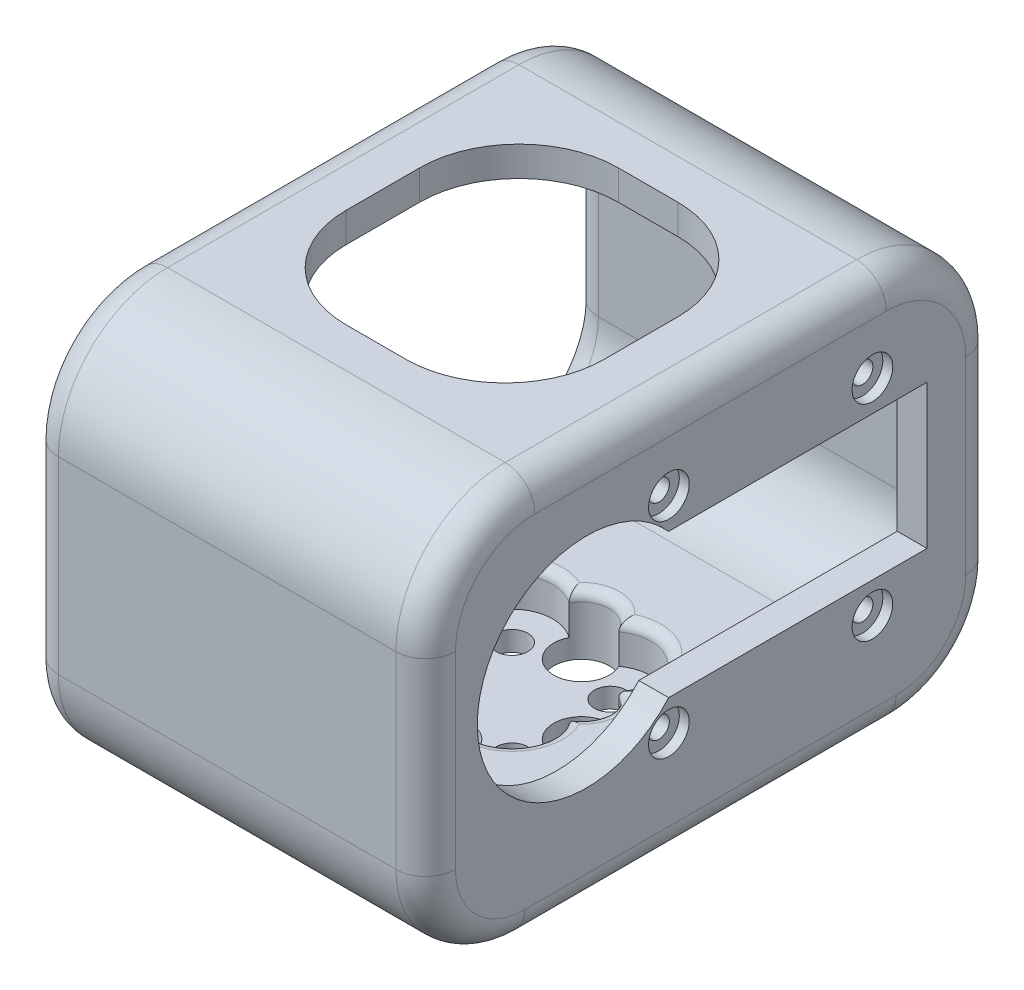
from build123d import *

# Parameters (mm, degrees)
BOSS_EXTRUDE1_DEPTH      = 40
BOSS_EXTRUDE2_DEPTH      = 16.2
BOSS_EXTRUDE2_DEPTH_BACK = 41.2
CUT_EXTRUDE1_DEPTH       = 62.316311043636674
CUT_EXTRUDE1_DEPTH_BACK  = 62.316311043636674
CUT_EXTRUDE3_DEPTH       = 37
CUT_EXTRUDE3_DEPTH_BACK  = 62.316311043636674
CUT_EXTRUDE4_REACH       = 71.982
SKETCH7_R                = 1.5999999999999999
SKETCH7_R_2              = 1.6000000000000019
SKETCH7_R_3              = 2.7999999999999985
SKETCH7_R_4              = 2.800000000000002
FILLET2_R                = 10
FILLET3_R                = 3
CUT_EXTRUDE5_REACH       = 71.982
FILLET4_R                = 10
CUT_EXTRUDE6_START       = -4
SKETCH9_R                = 4.100000000000003
SKETCH9_R_2              = 1.6000000000000019
SKETCH9_R_3              = 4.100000000000001
SKETCH9_R_4              = 1.5999999999999999
CUT_EXTRUDE6_DEPTH       = 4
CUT_EXTRUDE7_REACH       = 63.316
SKETCH10_R               = 1.050000000000002
SKETCH10_R_2             = 1.049999999999999
SKETCH10_R_3             = 1.0500000000000025
SKETCH10_R_4             = 1.0499999999999985
SKETCH10_3_R             = 2.0500000000000003
SKETCH10_3_R_2           = 1.050000000000002
SKETCH10_3_R_3           = 1.049999999999999
SKETCH10_3_R_4           = 2.0499999999999985
SKETCH10_3_R_5           = 1.0499999999999985
SKETCH10_3_R_6           = 1.0500000000000025
CUT_EXTRUDE8_DEPTH       = 1
CUT_EXTRUDE9_START       = -4
CUT_EXTRUDE9_DEPTH       = 4
FILLET5_R                = 1


with BuildPart() as part:
    # Sketch1 → Boss-Extrude1 (new body)
    with BuildSketch(Plane(origin=(0, 0, 0), x_dir=(0, 0, 1), z_dir=(1, 0, 0))):
        with BuildLine():
            Line((-30.19999999999992, 18.5), (5.199999999999948, 18.5))
            ThreePointArc((5.199999999999948, 18.5), (12.978174593052039, 15.278174593052016), (16.200000000000006, 7.49999999999992))
            Line((16.200000000000006, 7.49999999999992), (16.200000000000003, -7.499999999999942))
            ThreePointArc((16.200000000000003, -7.499999999999942), (12.978174593052016, -15.27817459305203), (5.199999999999922, -18.5))
            Line((5.199999999999922, -18.5), (-30.199999999999942, -18.5))
            ThreePointArc((-30.199999999999942, -18.5), (-37.97817459305203, -15.278174593052018), (-41.2, -7.49999999999992))
            Line((-41.2, -7.49999999999992), (-41.2, 7.499999999999923))
            ThreePointArc((-41.2, 7.499999999999923), (-37.978174593052024, 15.278174593052025), (-30.19999999999992, 18.5))
        make_face()
    extrude(amount=BOSS_EXTRUDE1_DEPTH)

    # Sketch5 → Boss-Extrude2 (add, two sides: drawn at the far end of the back side and taken through both)
    with BuildSketch(Plane(origin=(0, 0, 0), x_dir=(0, 1, 0), z_dir=(0, 0, 1)).offset(-BOSS_EXTRUDE2_DEPTH_BACK)):
        Polygon((-21.5, -9.6e-15), (0, 0), (0, -40), (-21.5, -40), align=None)
    extrude(amount=BOSS_EXTRUDE2_DEPTH + BOSS_EXTRUDE2_DEPTH_BACK)

    # Sketch1<9> → Cut-Extrude1 (cut, two sides: drawn at the far end of the back side and taken through both)
    with BuildSketch(Plane(origin=(0, 0, 0), x_dir=(0, 0, 1), z_dir=(1, 0, 0)).offset(-CUT_EXTRUDE1_DEPTH_BACK)):
        with BuildLine():
            ThreePointArc((-8.272696053887305, -7.2499999999998215), (11, -2.66e-15), (-8.272696053887302, 7.249999999999826))
            Line((-8.272696053887364, 7.2499999999998765), (-34.30020581413727, 7.2499999999999964))
            Line((-34.30020581413727, 7.2499999999999964), (-34.30020581413727, -7.2500000000000036))
            Line((-34.30020581413727, -7.250000000000004), (-8.272696053887366, -7.249999999999876))
        make_face()
    extrude(amount=CUT_EXTRUDE1_DEPTH + CUT_EXTRUDE1_DEPTH_BACK, mode=Mode.SUBTRACT)

    # Sketch1<10> → Cut-Extrude3 (cut, two sides: drawn at the far end of the back side and taken through both)
    with BuildSketch(Plane(origin=(0, 0, 0), x_dir=(0, 0, 1), z_dir=(1, 0, 0)).offset(-CUT_EXTRUDE3_DEPTH_BACK)):
        with BuildLine():
            Line((-38.199999999999996, 7.499999999999942), (-38.199999999999996, -7.499999999999942))
            ThreePointArc((-38.199999999999996, -7.499999999999942), (-35.85685424949238, -13.156854249492376), (-30.199999999999942, -15.5))
            Line((-30.199999999999942, -15.5), (5.1999999999999424, -15.5))
            ThreePointArc((5.1999999999999424, -15.5), (10.856854249492383, -13.15685424949238), (13.200000000000001, -7.499999999999942))
            Line((13.200000000000001, -7.499999999999942), (13.200000000000003, 7.499999999999942))
            ThreePointArc((13.200000000000003, 7.499999999999942), (10.856854249492384, 13.15685424949238), (5.199999999999948, 15.5))
            Line((5.199999999999948, 15.5), (-30.199999999999942, 15.5))
            ThreePointArc((-30.199999999999942, 15.5), (-35.85685424949238, 13.156854249492376), (-38.199999999999996, 7.499999999999942))
        make_face()
    extrude(amount=CUT_EXTRUDE3_DEPTH + CUT_EXTRUDE3_DEPTH_BACK, mode=Mode.SUBTRACT)

    # Sketch7 → Cut-Extrude4 (cut, up to next)
    with BuildSketch(Plane.XZ.offset(21.5), mode=Mode.PRIVATE) as cut_extrude4_sk1:
        with Locations(Location((15.049999999999999, -7.549999999999998, 0), (0, 0, 270))):
            Circle(SKETCH7_R)
    cut_extrude4_tool1 = extrude(cut_extrude4_sk1.sketch, amount=-CUT_EXTRUDE4_REACH, mode=Mode.PRIVATE) & part.part
    # Sketch7 → Cut-Extrude4 (cut, up to next)
    with BuildSketch(Plane.XZ.offset(21.5), mode=Mode.PRIVATE) as cut_extrude4_sk2:
        with Locations(Location((24.95, -7.549999999999998, 0), (0, 0, 270))):
            Circle(SKETCH7_R_2)
    cut_extrude4_tool2 = extrude(cut_extrude4_sk2.sketch, amount=-CUT_EXTRUDE4_REACH, mode=Mode.PRIVATE) & part.part
    # Sketch7 → Cut-Extrude4 (cut, up to next)
    with BuildSketch(Plane.XZ.offset(21.5), mode=Mode.PRIVATE) as cut_extrude4_sk3:
        with Locations(Location((24.950000000000003, -17.45, 0), (0, 0, 270))):
            Circle(SKETCH7_R_2)
    cut_extrude4_tool3 = extrude(cut_extrude4_sk3.sketch, amount=-CUT_EXTRUDE4_REACH, mode=Mode.PRIVATE) & part.part
    # Sketch7 → Cut-Extrude4 (cut, up to next)
    with BuildSketch(Plane.XZ.offset(21.5), mode=Mode.PRIVATE) as cut_extrude4_sk4:
        with Locations(Location((15.05, -17.45, 0), (0, 0, 270))):
            Circle(SKETCH7_R_2)
    cut_extrude4_tool4 = extrude(cut_extrude4_sk4.sketch, amount=-CUT_EXTRUDE4_REACH, mode=Mode.PRIVATE) & part.part
    # Sketch7 → Cut-Extrude4 (cut, up to next)
    with BuildSketch(Plane.XZ.offset(21.5), mode=Mode.PRIVATE) as cut_extrude4_sk5:
        with Locations(Location((12.999642866253186, -12.500000000000005, 0), (0, 0, 270))):
            Circle(SKETCH7_R_3)
    cut_extrude4_tool5 = extrude(cut_extrude4_sk5.sketch, amount=-CUT_EXTRUDE4_REACH, mode=Mode.PRIVATE) & part.part
    # Sketch7 → Cut-Extrude4 (cut, up to next)
    with BuildSketch(Plane.XZ.offset(21.5), mode=Mode.PRIVATE) as cut_extrude4_sk6:
        with Locations(Location((20.000000000000007, -5.499642866253184, 0), (0, 0, 270))):
            Circle(SKETCH7_R_4)
    cut_extrude4_tool6 = extrude(cut_extrude4_sk6.sketch, amount=-CUT_EXTRUDE4_REACH, mode=Mode.PRIVATE) & part.part
    # Sketch7 → Cut-Extrude4 (cut, up to next)
    with BuildSketch(Plane.XZ.offset(21.5), mode=Mode.PRIVATE) as cut_extrude4_sk7:
        with Locations(Location((20.00000000000001, -19.500357133746824, 0), (0, 0, 270))):
            Circle(SKETCH7_R_3)
    cut_extrude4_tool7 = extrude(cut_extrude4_sk7.sketch, amount=-CUT_EXTRUDE4_REACH, mode=Mode.PRIVATE) & part.part
    # Sketch7 → Cut-Extrude4 (cut, up to next)
    with BuildSketch(Plane.XZ.offset(21.5), mode=Mode.PRIVATE) as cut_extrude4_sk8:
        with Locations(Location((27.000357133746828, -12.5, 0), (0, 0, 270))):
            Circle(SKETCH7_R_3)
    cut_extrude4_tool8 = extrude(cut_extrude4_sk8.sketch, amount=-CUT_EXTRUDE4_REACH, mode=Mode.PRIVATE) & part.part
    add(cut_extrude4_tool1.solids().sort_by_distance((15.05, -21.5, -7.55))[0], mode=Mode.SUBTRACT)
    add(cut_extrude4_tool2.solids().sort_by_distance((24.95, -21.5, -7.55))[0], mode=Mode.SUBTRACT)
    add(cut_extrude4_tool3.solids().sort_by_distance((24.95, -21.5, -17.45))[0], mode=Mode.SUBTRACT)
    add(cut_extrude4_tool4.solids().sort_by_distance((15.05, -21.5, -17.45))[0], mode=Mode.SUBTRACT)
    add(cut_extrude4_tool5.solids().sort_by_distance((12.999643, -21.5, -12.5))[0], mode=Mode.SUBTRACT)
    add(cut_extrude4_tool6.solids().sort_by_distance((20, -21.5, -5.499643))[0], mode=Mode.SUBTRACT)
    add(cut_extrude4_tool7.solids().sort_by_distance((20, -21.5, -19.500357))[0], mode=Mode.SUBTRACT)
    add(cut_extrude4_tool8.solids().sort_by_distance((27.000357, -21.5, -12.5))[0], mode=Mode.SUBTRACT)

    # Fillet2
    fillet2_edges = [part.edges().sort_by_distance(p)[0] for p in [
        (20.000000000000004, -21.5, -41.2),
        (20.000000000000004, -21.5, 16.2),
    ]]
    fillet(fillet2_edges, radius=FILLET2_R)

    # Fillet3
    # the kernel refuses this fillet: 3 mm, written as the material it takes off along each edge
    with BuildSketch(Plane(origin=(40, 7.500000000000001, -30.200000000000006), x_dir=(0, 1, 5.81e-15), z_dir=(0, -5.81e-15, 1))) as fillet3_piece_1:
        with BuildLine():
            CenterArc((11 - FILLET3_R, FILLET3_R), FILLET3_R, 270, 90)
            Line((11, FILLET3_R), (11, 0))
            Line((11, 0), (11 - FILLET3_R, 0))
        make_face()
    revolve(axis=Axis((40, 7.500000000000001, -30.200000000000006), (-1, 0, 0)), revolution_arc=90.00000000000077, mode=Mode.SUBTRACT)
    with BuildSketch(Plane(origin=(0, 7.499999999999996, 5.199999999999998), x_dir=(0, -4.84e-15, 1), z_dir=(0, -1, -4.84e-15))) as fillet3_piece_2:
        with BuildLine():
            CenterArc((11.000000000000004 - FILLET3_R, -FILLET3_R), FILLET3_R, 8.48e-15, 90)
            Line((11.000000000000004, -FILLET3_R), (11.000000000000004, 0))
            Line((11.000000000000004, 0), (11.000000000000004 - FILLET3_R, 0))
        make_face()
    revolve(axis=Axis((0, 7.499999999999996, 5.199999999999998), (-1, 0, 0)), revolution_arc=90.00000000000067, mode=Mode.SUBTRACT)
    with BuildSketch(Plane(origin=(0, 18.5, 5.199999999999922), x_dir=(0, -1, 0), z_dir=(0, 0, -1))) as fillet3_piece_3:
        with BuildLine():
            CenterArc((FILLET3_R, -FILLET3_R), FILLET3_R, 90, 90)
            Line((0, -FILLET3_R), (0, 0))
            Line((0, 0), (FILLET3_R, 0))
        make_face()
    extrude(amount=35.399999999999864, mode=Mode.SUBTRACT)
    with BuildSketch(Plane(origin=(0, 7.500000000000001, -30.200000000000006), x_dir=(0, 1, 5.81e-15), z_dir=(0, -5.81e-15, 1))) as fillet3_piece_4:
        with BuildLine():
            CenterArc((11 - FILLET3_R, -FILLET3_R), FILLET3_R, 0, 90)
            Line((11 - FILLET3_R, 4.4e-16), (11, 0))
            Line((11, 0), (11, -FILLET3_R))
        make_face()
    revolve(axis=Axis((0, 7.500000000000001, -30.200000000000006), (-1, 0, 0)), revolution_arc=90.00000000000077, mode=Mode.SUBTRACT)
    with BuildSketch(Plane(origin=(40, 18.5, 5.199999999999922), x_dir=(0, -1, 0), z_dir=(0, 0, -1))) as fillet3_piece_5:
        with BuildLine():
            CenterArc((FILLET3_R, FILLET3_R), FILLET3_R, 180, 90)
            Line((0, FILLET3_R), (0, 0))
            Line((0, 0), (FILLET3_R, 0))
        make_face()
    extrude(amount=35.399999999999864, mode=Mode.SUBTRACT)
    with BuildSketch(Plane(origin=(9.6e-15, -21.5, -31.200000000000003), x_dir=(-3.2e-15, 1, 0), z_dir=(0, 0, 1))) as fillet3_piece_6:
        with BuildLine():
            CenterArc((FILLET3_R, -FILLET3_R), FILLET3_R, 89.99999999999982, 90.00000000000013)
            Line((-9.6e-15, -FILLET3_R), (0, 0))
            Line((0, 0), (FILLET3_R, 0))
        make_face()
    extrude(amount=37.40000000000001, mode=Mode.SUBTRACT)
    with BuildSketch(Plane(origin=(40, -21.5, -31.200000000000003), x_dir=(0, 1, 0), z_dir=(0, 0, 1))) as fillet3_piece_7:
        with BuildLine():
            CenterArc((FILLET3_R, FILLET3_R), FILLET3_R, 180, 90)
            Line((0, FILLET3_R), (0, 0))
            Line((0, 0), (FILLET3_R, 0))
        make_face()
    extrude(amount=37.40000000000001, mode=Mode.SUBTRACT)
    with BuildSketch(Plane(origin=(40, 7.499999999999942, 16.200000000000003), x_dir=(0, 1.2e-16, -1), z_dir=(0, -1, -1.2e-16))) as fillet3_piece_8:
        with BuildLine():
            CenterArc((FILLET3_R, -FILLET3_R), FILLET3_R, 90, 90)
            Line((0, -FILLET3_R), (0, 0))
            Line((0, 0), (FILLET3_R, 0))
        make_face()
    extrude(amount=18.99999999999994, mode=Mode.SUBTRACT)
    with BuildSketch(Plane(origin=(40, 7.49999999999992, -41.2), x_dir=(-1, 0, 0), z_dir=(0, -1, 0))) as fillet3_piece_9:
        with BuildLine():
            CenterArc((FILLET3_R, -FILLET3_R), FILLET3_R, 90, 90)
            Line((0, -FILLET3_R), (0, 0))
            Line((0, 0), (FILLET3_R, 0))
        make_face()
    extrude(amount=18.999999999999922, mode=Mode.SUBTRACT)
    with BuildSketch(Plane(origin=(40, -11.5, 6.200000000000008), x_dir=(0, -1, -9e-17), z_dir=(0, 9e-17, -1))) as fillet3_piece_10:
        with BuildLine():
            CenterArc((10 - FILLET3_R, FILLET3_R), FILLET3_R, 270, 90)
            Line((10, FILLET3_R), (10, 0))
            Line((10, 0), (10 - FILLET3_R, 0))
        make_face()
    revolve(axis=Axis((40, -11.5, 6.200000000000008), (-1, 0, 0)), revolution_arc=90.00000000000003, mode=Mode.SUBTRACT)
    with BuildSketch(Plane(origin=(40, -11.500000000000002, -31.200000000000003), x_dir=(0, 0, -1), z_dir=(0, 1, 0))) as fillet3_piece_11:
        with BuildLine():
            CenterArc((10 - FILLET3_R, FILLET3_R), FILLET3_R, 270, 90)
            Line((10, FILLET3_R), (10, 0))
            Line((10, 0), (10 - FILLET3_R, 0))
        make_face()
    revolve(axis=Axis((40, -11.500000000000002, -31.200000000000003), (-1, 0, 0)), revolution_arc=90, mode=Mode.SUBTRACT)
    with BuildSketch(Plane(origin=(6.29e-15, -11.500000000000002, -41.2), x_dir=(1, 3.3e-16, 0), z_dir=(-3.3e-16, 1, 0))) as fillet3_piece_12:
        with BuildLine():
            CenterArc((FILLET3_R, -FILLET3_R), FILLET3_R, 90, 90)
            Line((-5.1e-16, -FILLET3_R), (0, 0))
            Line((0, 0), (FILLET3_R, 0))
        make_face()
    extrude(amount=18.999999999999922, mode=Mode.SUBTRACT)
    with BuildSketch(Plane(origin=(6.29e-15, -11.499999999999998, 16.2), x_dir=(-2.1e-15, 1.2e-16, -1), z_dir=(-3.3e-16, 1, 1.2e-16))) as fillet3_piece_13:
        with BuildLine():
            CenterArc((FILLET3_R, -FILLET3_R), FILLET3_R, 89.99999999999989, 90.00000000000011)
            Line((-9.84e-15, -FILLET3_R), (0, 0))
            Line((0, 0), (FILLET3_R, 0))
        make_face()
    extrude(amount=18.999999999999943, mode=Mode.SUBTRACT)
    with BuildSketch(Plane(origin=(0, -11.5, 6.200000000000008), x_dir=(0, -1, -9e-17), z_dir=(0, 9e-17, -1))) as fillet3_piece_14:
        with BuildLine():
            CenterArc((10 - FILLET3_R, -FILLET3_R), FILLET3_R, 0, 90)
            Line((10, -FILLET3_R), (10, 0))
            Line((10, 0), (10 - FILLET3_R, 0))
        make_face()
    revolve(axis=Axis((0, -11.5, 6.200000000000008), (-1, 0, 0)), revolution_arc=90, mode=Mode.SUBTRACT)
    with BuildSketch(Plane(origin=(0, -11.500000000000002, -31.200000000000003), x_dir=(0, 0, -1), z_dir=(0, 1, 0))) as fillet3_piece_15:
        with BuildLine():
            CenterArc((10 - FILLET3_R, -FILLET3_R), FILLET3_R, 0, 90)
            Line((10 - FILLET3_R, 0), (10, 0))
            Line((10, 0), (10, -FILLET3_R))
        make_face()
    revolve(axis=Axis((0, -11.500000000000002, -31.200000000000003), (-1, 0, 0)), revolution_arc=90, mode=Mode.SUBTRACT)
    with BuildSketch(Plane(origin=(40, 7.499999999999996, 5.199999999999998), x_dir=(0, -4.84e-15, 1), z_dir=(0, -1, -4.84e-15))) as fillet3_piece_16:
        with BuildLine():
            CenterArc((11.000000000000004 - FILLET3_R, FILLET3_R), FILLET3_R, 270, 90)
            Line((11.000000000000004, FILLET3_R), (11.000000000000004, 0))
            Line((11.000000000000004, 0), (11.000000000000004 - FILLET3_R, 0))
        make_face()
    revolve(axis=Axis((40, 7.499999999999996, 5.199999999999998), (-1, 0, 0)), revolution_arc=90.00000000000067, mode=Mode.SUBTRACT)
    with BuildSketch(Plane(origin=(0, -7.499999999999998, -30.199999999999992), x_dir=(0, 7.33e-15, -1), z_dir=(0, 1, 7.33e-15))) as fillet3_piece_17:
        with BuildLine():
            CenterArc((8.000000000000004 + FILLET3_R, -FILLET3_R), FILLET3_R, 90, 90)
            Line((8.000000000000004, -FILLET3_R), (8.000000000000004, 0))
            Line((8.000000000000004, 0), (8.000000000000004 + FILLET3_R, 0))
        make_face()
    revolve(axis=Axis((0, -7.499999999999998, -30.199999999999992), (-1, 0, 0)), revolution_arc=90.00000000000077, mode=Mode.SUBTRACT)
    with BuildSketch(Plane(origin=(0, -7.499999999999942, -38.199999999999996), x_dir=(0, 0, -1), z_dir=(0, 1, 0))) as fillet3_piece_18:
        with BuildLine():
            CenterArc((FILLET3_R, -FILLET3_R), FILLET3_R, 90, 90)
            Line((0, -FILLET3_R), (0, 0))
            Line((0, 0), (FILLET3_R, 0))
        make_face()
    extrude(amount=14.999999999999883, mode=Mode.SUBTRACT)
    with BuildSketch(Plane(origin=(0, 7.499999999999999, -30.199999999999992), x_dir=(0, 1, 6.22e-15), z_dir=(0, -6.22e-15, 1))) as fillet3_piece_19:
        with BuildLine():
            CenterArc((8 + FILLET3_R, -FILLET3_R), FILLET3_R, 90, 90)
            Line((8, -FILLET3_R), (8, 0))
            Line((8, 0), (8 + FILLET3_R, 0))
        make_face()
    revolve(axis=Axis((0, 7.499999999999999, -30.199999999999992), (-1, 0, 0)), revolution_arc=90.00000000000077, mode=Mode.SUBTRACT)
    with BuildSketch(Plane(origin=(0, 15.5, -30.199999999999942), x_dir=(0, 1, 0), z_dir=(0, 0, 1))) as fillet3_piece_20:
        with BuildLine():
            CenterArc((FILLET3_R, -FILLET3_R), FILLET3_R, 90, 90)
            Line((0, -FILLET3_R), (0, 0))
            Line((0, 0), (FILLET3_R, 0))
        make_face()
    extrude(amount=35.399999999999885, mode=Mode.SUBTRACT)
    with BuildSketch(Plane(origin=(0, 7.5000000000000036, 5.200000000000005), x_dir=(0, -8.44e-15, 1), z_dir=(0, -1, -8.44e-15))) as fillet3_piece_21:
        with BuildLine():
            CenterArc((7.9999999999999964 + FILLET3_R, -FILLET3_R), FILLET3_R, 90, 90)
            Line((7.999999999999998, -FILLET3_R), (7.9999999999999964, 0))
            Line((7.9999999999999964, 0), (7.9999999999999964 + FILLET3_R, 0))
        make_face()
    revolve(axis=Axis((0, 7.5000000000000036, 5.200000000000005), (-1, 0, 0)), revolution_arc=90.00000000000091, mode=Mode.SUBTRACT)
    with BuildSketch(Plane(origin=(0, 7.499999999999942, 13.200000000000001), x_dir=(0, 1.2e-16, 1), z_dir=(0, -1, 1.2e-16))) as fillet3_piece_22:
        with BuildLine():
            CenterArc((FILLET3_R, -FILLET3_R), FILLET3_R, 90, 90)
            Line((1.78e-15, -FILLET3_R), (0, 0))
            Line((0, 0), (FILLET3_R, 0))
        make_face()
    extrude(amount=14.999999999999885, mode=Mode.SUBTRACT)
    with BuildSketch(Plane(origin=(0, -7.500000000000003, 5.200000000000005), x_dir=(0, -1, -6.88e-15), z_dir=(0, 6.88e-15, -1))) as fillet3_piece_23:
        with BuildLine():
            CenterArc((7.999999999999997 + FILLET3_R, -FILLET3_R), FILLET3_R, 90, 90)
            Line((7.999999999999997, -FILLET3_R), (7.999999999999997, 0))
            Line((7.999999999999997, 0), (7.999999999999997 + FILLET3_R, 0))
        make_face()
    revolve(axis=Axis((0, -7.500000000000003, 5.200000000000005), (-1, 0, 0)), revolution_arc=90.00000000000081, mode=Mode.SUBTRACT)
    with BuildSketch(Plane(origin=(0, -15.5, 5.199999999999948), x_dir=(0, -1, 0), z_dir=(0, 0, -1))) as fillet3_piece_24:
        with BuildLine():
            CenterArc((FILLET3_R, -FILLET3_R), FILLET3_R, 90, 90)
            Line((0, -FILLET3_R), (0, 0))
            Line((0, 0), (FILLET3_R, 0))
        make_face()
    extrude(amount=35.39999999999989, mode=Mode.SUBTRACT)

    # Sketch8 → Cut-Extrude5 (cut, up to next)
    with BuildSketch(Plane(origin=(0, 18.5, 0), x_dir=(-1, 0, 0), z_dir=(0, 1, 0)), mode=Mode.PRIVATE) as cut_extrude5_sk1:
        Polygon((-33, 1.1999999999999216), (-7.000000000000003, 1.1999999999999216), (-6.999999999999999, -26.199999999999942), (-33, -26.199999999999942), align=None)
    cut_extrude5_tool1 = extrude(cut_extrude5_sk1.sketch, amount=-CUT_EXTRUDE5_REACH, mode=Mode.PRIVATE) & part.part
    add(cut_extrude5_tool1.solids().sort_by_distance((20, 18.5, -12.5))[0], mode=Mode.SUBTRACT)

    # Fillet4
    fillet4_edges = [part.edges().sort_by_distance(p)[0] for p in [
        (6.999999999999999, 17, -26.199999999999942),
        (7.000000000000003, 17, 1.1999999999999216),
        (33, 17, 1.1999999999999216),
        (33, 17, -26.199999999999942),
    ]]
    fillet(fillet4_edges, radius=FILLET4_R)

    # Sketch9 → Cut-Extrude6 (cut)
    # profile 1 of 4: a face of its own
    with BuildSketch(Plane(origin=(0, -15.5, 0), x_dir=(-1, 0, 0), z_dir=(0, 1, 0)).offset(CUT_EXTRUDE6_START)):
        with Locations((-24.95, -7.549999999999998)):
            Circle(SKETCH9_R)
        with Locations(Location((-24.95, -7.549999999999998, 0), (0, 0, 270))):
            Circle(SKETCH9_R_2, mode=Mode.SUBTRACT)
    # profile 2 of 4: a face of its own
    with BuildSketch(Plane(origin=(0, -15.5, 0), x_dir=(-1, 0, 0), z_dir=(0, 1, 0)).offset(CUT_EXTRUDE6_START)):
        with Locations((-15.049999999999999, -7.549999999999998)):
            Circle(SKETCH9_R_3)
        with Locations(Location((-15.049999999999999, -7.549999999999998, 0), (0, 0, 270))):
            Circle(SKETCH9_R_4, mode=Mode.SUBTRACT)
    # profile 3 of 4: a face of its own
    with BuildSketch(Plane(origin=(0, -15.5, 0), x_dir=(-1, 0, 0), z_dir=(0, 1, 0)).offset(CUT_EXTRUDE6_START)):
        with Locations((-15.05, -17.45)):
            Circle(SKETCH9_R)
        with Locations(Location((-15.05, -17.45, 0), (0, 0, 270))):
            Circle(SKETCH9_R_2, mode=Mode.SUBTRACT)
    # profile 4 of 4: a face of its own
    with BuildSketch(Plane(origin=(0, -15.5, 0), x_dir=(-1, 0, 0), z_dir=(0, 1, 0)).offset(CUT_EXTRUDE6_START)):
        with Locations((-24.950000000000003, -17.45)):
            Circle(SKETCH9_R)
    extrude(amount=CUT_EXTRUDE6_DEPTH, mode=Mode.SUBTRACT)

    # Sketch10 → Cut-Extrude7 (cut, up to next)
    with BuildSketch(Plane.YZ.offset(40), mode=Mode.PRIVATE) as cut_extrude7_sk1:
        with Locations(Location((-10.349999999999998, -8.300000000000002, 0), (0, 0, 270))):
            Circle(SKETCH10_R)
    cut_extrude7_tool1 = extrude(cut_extrude7_sk1.sketch, amount=-CUT_EXTRUDE7_REACH, mode=Mode.PRIVATE) & part.part
    # Sketch10 → Cut-Extrude7 (cut, up to next)
    with BuildSketch(Plane.YZ.offset(40), mode=Mode.PRIVATE) as cut_extrude7_sk2:
        with Locations(Location((10.350000000000001, -8.3, 0), (0, 0, 270))):
            Circle(SKETCH10_R_2)
    cut_extrude7_tool2 = extrude(cut_extrude7_sk2.sketch, amount=-CUT_EXTRUDE7_REACH, mode=Mode.PRIVATE) & part.part
    # Sketch10 → Cut-Extrude7 (cut, up to next)
    with BuildSketch(Plane.YZ.offset(40), mode=Mode.PRIVATE) as cut_extrude7_sk3:
        with Locations(Location((-10.349999999999998, -28.800000000000004, 0), (0, 0, 270))):
            Circle(SKETCH10_R_3)
    cut_extrude7_tool3 = extrude(cut_extrude7_sk3.sketch, amount=-CUT_EXTRUDE7_REACH, mode=Mode.PRIVATE) & part.part
    # Sketch10 → Cut-Extrude7 (cut, up to next)
    with BuildSketch(Plane.YZ.offset(40), mode=Mode.PRIVATE) as cut_extrude7_sk4:
        with Locations(Location((10.350000000000005, -28.8, 0), (0, 0, 270))):
            Circle(SKETCH10_R_4)
    cut_extrude7_tool4 = extrude(cut_extrude7_sk4.sketch, amount=-CUT_EXTRUDE7_REACH, mode=Mode.PRIVATE) & part.part
    add(cut_extrude7_tool1.solids().sort_by_distance((40, -10.35, -8.3))[0], mode=Mode.SUBTRACT)
    add(cut_extrude7_tool2.solids().sort_by_distance((40, 10.35, -8.3))[0], mode=Mode.SUBTRACT)
    add(cut_extrude7_tool3.solids().sort_by_distance((40, -10.35, -28.8))[0], mode=Mode.SUBTRACT)
    add(cut_extrude7_tool4.solids().sort_by_distance((40, 10.35, -28.8))[0], mode=Mode.SUBTRACT)

    # Sketch10<3> → Cut-Extrude8 (cut)
    # profile 1 of 4: a face of its own
    with BuildSketch(Plane.YZ.offset(40)):
        with Locations(Location((-10.349999999999998, -8.300000000000002, 0), (0, 0, 270))):
            Circle(SKETCH10_3_R)
        with Locations(Location((-10.349999999999998, -8.300000000000002, 0), (0, 0, 270))):
            Circle(SKETCH10_3_R_2, mode=Mode.SUBTRACT)
    # profile 2 of 4: a face of its own
    with BuildSketch(Plane.YZ.offset(40)):
        with Locations(Location((10.350000000000001, -8.3, 0), (0, 0, 270))):
            Circle(SKETCH10_3_R)
        with Locations(Location((10.350000000000001, -8.3, 0), (0, 0, 270))):
            Circle(SKETCH10_3_R_3, mode=Mode.SUBTRACT)
    # profile 3 of 4: a face of its own
    with BuildSketch(Plane.YZ.offset(40)):
        with Locations(Location((10.350000000000005, -28.8, 0), (0, 0, 270))):
            Circle(SKETCH10_3_R_4)
        with Locations(Location((10.350000000000005, -28.8, 0), (0, 0, 270))):
            Circle(SKETCH10_3_R_5, mode=Mode.SUBTRACT)
    # profile 4 of 4: a face of its own
    with BuildSketch(Plane.YZ.offset(40)):
        with Locations(Location((-10.349999999999998, -28.800000000000004, 0), (0, 0, 270))):
            Circle(SKETCH10_3_R_4)
        with Locations(Location((-10.349999999999998, -28.800000000000004, 0), (0, 0, 270))):
            Circle(SKETCH10_3_R_6, mode=Mode.SUBTRACT)
    extrude(amount=-CUT_EXTRUDE8_DEPTH, mode=Mode.SUBTRACT)

    # Sketch11 → Cut-Extrude9 (cut)
    with BuildSketch(Plane(origin=(0, -15.5, 0), x_dir=(-1, 0, 0), z_dir=(0, 1, 0)).offset(CUT_EXTRUDE9_START)):
        with BuildLine():
            ThreePointArc((-24.347105222096452, -13.394569333994644), (-24.200357133746827, -12.5), (-24.347105222096452, -11.605430666005358))
            ThreePointArc((-24.347105222096452, -11.605430666005358), (-22.05086219713516, -10.449137802864854), (-20.894569333994646, -8.152894777903567))
            ThreePointArc((-20.894569333994646, -8.152894777903567), (-20, -8.299642866253189), (-19.105430666005354, -8.152894777903562))
            ThreePointArc((-19.105430666005354, -8.152894777903562), (-17.949137802864843, -10.449137802864847), (-15.652894777903558, -11.605430666005352))
            ThreePointArc((-15.652894777903558, -11.605430666005352), (-15.799642866253185, -12.499999999999998), (-15.652894777903562, -13.394569333994644))
            ThreePointArc((-15.652894777903562, -13.394569333994644), (-17.949137802864854, -14.550862197135157), (-19.105430666005358, -16.847105222096452))
            ThreePointArc((-19.105430666005358, -16.847105222096452), (-20, -16.700357133746827), (-20.894569333994646, -16.847105222096445))
            ThreePointArc((-20.894569333994646, -16.847105222096445), (-22.050862197135157, -14.550862197135151), (-24.347105222096452, -13.394569333994644))
        make_face()
    extrude(amount=CUT_EXTRUDE9_DEPTH, mode=Mode.SUBTRACT)

    # Fillet5
    fillet5_edges = [part.edges().sort_by_distance(p)[0] for p in [
        (10.199642866253187, -15.5, -12.500000000000053),
        (18.523858721958145, -15.5, -21.87964419655806),
        (29.800357133746825, -15.5, -12.499999999999996),
        (20.000000000000014, -15.5, -2.6996428662531824),
        (27.84913780286484, -15.5, -20.34913780286486),
        (12.150862197135156, -15.5, -20.34913780286485),
        (12.150862197135165, -15.5, -4.65086219713514),
        (27.849137802864835, -15.5, -4.6508621971351385),
    ]]
    fillet(fillet5_edges, radius=FILLET5_R)


solid = part.part
